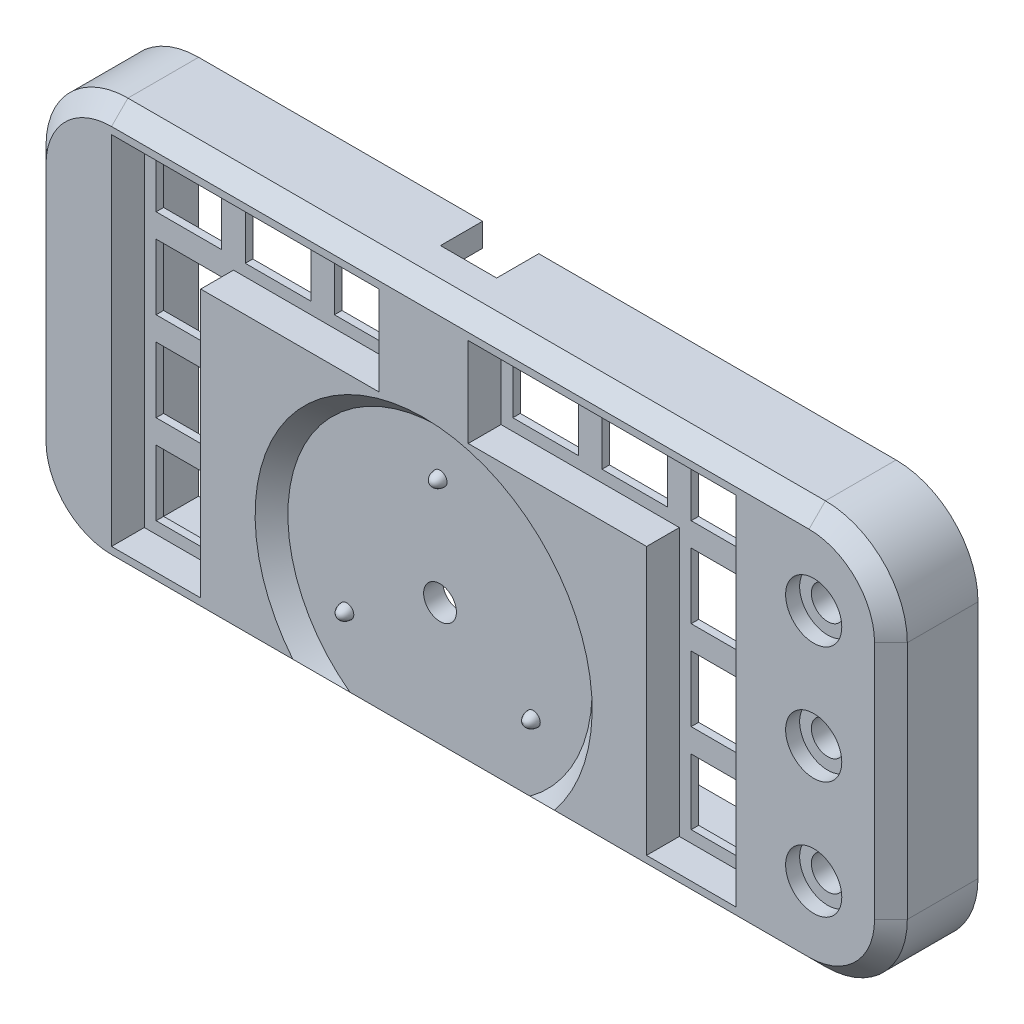
from build123d import *
from build123d.topology import SkipClean

# Parameters (mm, degrees)
CROQUIS1_W                          = 157.5
CROQUIS1_H                          = 76.2
CROQUIS1_R                          = 3.5
CROQUIS1_W_2                        = 14
CROQUIS1_H_2                        = 14
SALIENTE_EXTRUIR1_DEPTH             = 1.6
SALIENTE_EXTRUIR4_REACH             = 176.972
CROQUIS2_R                          = 3.5
SALIENTE_EXTRUIR4_DIRECTION_2_DEPTH = 3.5
SALIENTE_EXTRUIR5_START             = 3.5
CROQUIS3_R                          = 3.5
SALIENTE_EXTRUIR5_DEPTH             = 3.5
CHAFL_N1_SIZE                       = 3.5
CROQUIS4_W                          = 14.5
CROQUIS4_H                          = 14.5
CORTAR_EXTRUIR1_DEPTH               = 1
SALIENTE_EXTRUIR6_DEPTH             = 10
CROQUIS7_R                          = 4
SALIENTE_EXTRUIR7_DEPTH             = 10
CROQUIS8_R                          = 2
CORTAR_EXTRUIR2_DEPTH               = 5
CROQUIS9_W                          = 20
CROQUIS9_H                          = 32
SALIENTE_EXTRUIR8_DEPTH             = 10
CORTAR_EXTRUIR4_DEPTH               = 32
CROQUIS14_W                         = 20
CROQUIS14_H                         = 4.25
CORTAR_EXTRUIR8_DEPTH               = 22
CORTAR_EXTRUIR5_DEPTH               = 186.607785397
MATRIZC1_COUNT                      = 3
CROQUIS17_W                         = 1.5
CROQUIS17_H                         = 2
CORTAR_EXTRUIR9_DEPTH               = 2
CROQUIS18_R                         = 6
CORTAR_EXTRUIR10_DEPTH              = 3


with BuildPart() as part:
    # Croquis1 → Saliente-Extruir1 (new body)
    with BuildSketch(Plane.XY):
        with Locations((78.75, 38.1)):
            Rectangle(CROQUIS1_W, CROQUIS1_H)
        with Locations((150, 38.1)):
            Circle(CROQUIS1_R, mode=Mode.SUBTRACT)
        with Locations((150, 63.1)):
            Circle(CROQUIS1_R, mode=Mode.SUBTRACT)
        with Locations((150, 13.1)):
            Circle(CROQUIS1_R, mode=Mode.SUBTRACT)
        with Locations((66.67, 21.2)):
            Circle(CROQUIS1_R, mode=Mode.SUBTRACT)
        with Locations((28.575, 66.675)):
            Rectangle(CROQUIS1_W_2, CROQUIS1_H_2, mode=Mode.SUBTRACT)
        with Locations((9.525, 66.675)):
            Rectangle(CROQUIS1_W_2, CROQUIS1_H_2, mode=Mode.SUBTRACT)
        with Locations((47.625, 66.675)):
            Rectangle(CROQUIS1_W_2, CROQUIS1_H_2, mode=Mode.SUBTRACT)
        with Locations((85.725, 66.675)):
            Rectangle(CROQUIS1_W_2, CROQUIS1_H_2, mode=Mode.SUBTRACT)
        with Locations((104.775, 66.675)):
            Rectangle(CROQUIS1_W_2, CROQUIS1_H_2, mode=Mode.SUBTRACT)
        with Locations((123.825, 66.675)):
            Rectangle(CROQUIS1_W_2, CROQUIS1_H_2, mode=Mode.SUBTRACT)
        with Locations((9.525, 47.625)):
            Rectangle(CROQUIS1_W_2, CROQUIS1_H_2, mode=Mode.SUBTRACT)
        with Locations((123.825, 47.625)):
            Rectangle(CROQUIS1_W_2, CROQUIS1_H_2, mode=Mode.SUBTRACT)
        with Locations((9.525, 28.575)):
            Rectangle(CROQUIS1_W_2, CROQUIS1_H_2, mode=Mode.SUBTRACT)
        with Locations((123.825, 28.575)):
            Rectangle(CROQUIS1_W_2, CROQUIS1_H_2, mode=Mode.SUBTRACT)
        with Locations((9.525, 9.525)):
            Rectangle(CROQUIS1_W_2, CROQUIS1_H_2, mode=Mode.SUBTRACT)
        with Locations((123.825, 9.525)):
            Rectangle(CROQUIS1_W_2, CROQUIS1_H_2, mode=Mode.SUBTRACT)
    extrude(amount=-SALIENTE_EXTRUIR1_DEPTH)

    # Saliente-Extruir4: up to this face of the body (flat: up to its plane)
    saliente_extruir4_end = Plane(part.part.faces().sort_by_distance((80.923565815, 35.80920227, -1.6))[0])
    # Croquis2 → Saliente-Extruir4 (add, up to the picked face)
    with BuildSketch(Plane.XY, mode=Mode.PRIVATE) as saliente_extruir4_sk1:
        with BuildLine():
            Line((0, -5), (66.67, -5))
            Line((66.67, -5), (149, -5))
            ThreePointArc((149, -5), (161.374368671, 0.125631329), (166.5, 12.5))
            Line((166.5, 12.5), (166.5, 63.7))
            ThreePointArc((166.5, 63.7), (161.374368671, 76.074368671), (149, 81.2))
            Line((149, 81.2), (0, 81.2))
            ThreePointArc((0, 81.2), (-12.374368671, 76.074368671), (-17.5, 63.7))
            Line((-17.5, 63.7), (-17.5, 12.5))
            ThreePointArc((-17.5, 12.5), (-12.374368671, 0.125631329), (0, -5))
        make_face()
        with Locations((150, 13.1)):
            Circle(CROQUIS2_R, mode=Mode.SUBTRACT)
        with Locations((150, 63.1)):
            Circle(CROQUIS2_R, mode=Mode.SUBTRACT)
        with Locations((150, 38.1)):
            Circle(CROQUIS2_R, mode=Mode.SUBTRACT)
        with Locations((66.67, 21.2)):
            Circle(CROQUIS2_R, mode=Mode.SUBTRACT)
        Polygon((19.05, 0), (0, 0), (0, 76.2), (57.15, 76.2), (57.15, 57.15), (19.05, 57.15), align=None, mode=Mode.SUBTRACT)
        Polygon((114.3, 0), (133.35, 0), (133.35, 76.2), (76.2, 76.2), (76.2, 57.15), (114.3, 57.15), align=None, mode=Mode.SUBTRACT)
    saliente_extruir4_tool1 = split(extrude(saliente_extruir4_sk1.sketch, amount=-SALIENTE_EXTRUIR4_REACH, mode=Mode.PRIVATE), bisect_by=saliente_extruir4_end, keep=Keep.BOTH, mode=Mode.PRIVATE)
    add(saliente_extruir4_tool1.solids().sort_by(Axis((76.814077, 34.418078, 0), (0, 0, -1)))[0])

    # Croquis2 → Saliente-Extruir4 direction 2 (add)
    with BuildSketch(Plane.XY):
        with BuildLine():
            Line((0, -5), (66.67, -5))
            Line((66.67, -5), (149, -5))
            ThreePointArc((149, -5), (161.374368671, 0.125631329), (166.5, 12.5))
            Line((166.5, 12.5), (166.5, 63.7))
            ThreePointArc((166.5, 63.7), (161.374368671, 76.074368671), (149, 81.2))
            Line((149, 81.2), (0, 81.2))
            ThreePointArc((0, 81.2), (-12.374368671, 76.074368671), (-17.5, 63.7))
            Line((-17.5, 63.7), (-17.5, 12.5))
            ThreePointArc((-17.5, 12.5), (-12.374368671, 0.125631329), (0, -5))
        make_face()
        with Locations((150, 13.1)):
            Circle(CROQUIS2_R, mode=Mode.SUBTRACT)
        with Locations((150, 63.1)):
            Circle(CROQUIS2_R, mode=Mode.SUBTRACT)
        with Locations((150, 38.1)):
            Circle(CROQUIS2_R, mode=Mode.SUBTRACT)
        with Locations((66.67, 21.2)):
            Circle(CROQUIS2_R, mode=Mode.SUBTRACT)
        Polygon((19.05, 0), (0, 0), (0, 76.2), (57.15, 76.2), (57.15, 57.15), (19.05, 57.15), align=None, mode=Mode.SUBTRACT)
        Polygon((114.3, 0), (133.35, 0), (133.35, 76.2), (76.2, 76.2), (76.2, 57.15), (114.3, 57.15), align=None, mode=Mode.SUBTRACT)
    extrude(amount=SALIENTE_EXTRUIR4_DIRECTION_2_DEPTH)

    # Croquis3 → Saliente-Extruir5 (add)
    with BuildSketch(Plane.XY.offset(3.5).offset(SALIENTE_EXTRUIR5_START)):
        with BuildLine():
            Line((85.900444613, -5), (149, -5))
            ThreePointArc((149, -5), (161.374368671, 0.125631329), (166.5, 12.5))
            Line((166.5, 12.5), (166.5, 63.7))
            ThreePointArc((166.5, 63.7), (161.374368671, 76.074368671), (149, 81.2))
            Line((149, 81.2), (0, 81.2))
            ThreePointArc((0, 81.2), (-12.374368671, 76.074368671), (-17.5, 63.7))
            Line((-17.5, 63.7), (-17.5, 12.5))
            ThreePointArc((-17.5, 12.5), (-12.374368671, 0.125631329), (0, -5))
            Line((0, -5), (47.439555387, -5))
            ThreePointArc((47.439555387, -5), (66.67, 53.7), (85.900444613, -5))
        make_face()
        with Locations((150, 63.1)):
            Circle(CROQUIS3_R, mode=Mode.SUBTRACT)
        with Locations((150, 38.1)):
            Circle(CROQUIS3_R, mode=Mode.SUBTRACT)
        with Locations((150, 13.1)):
            Circle(CROQUIS3_R, mode=Mode.SUBTRACT)
        Polygon((76.2, 57.15), (114.3, 57.15), (114.3, 0), (133.35, 0), (133.35, 76.2), (76.2, 76.2), align=None, mode=Mode.SUBTRACT)
        Polygon((19.05, 0), (0, 0), (0, 76.2), (57.15, 76.2), (57.15, 57.15), (19.05, 57.15), align=None, mode=Mode.SUBTRACT)
    extrude(amount=-SALIENTE_EXTRUIR5_DEPTH)

    # Chaflán1
    chafl_n1_edges = [part.edges().sort_by_distance(p)[0] for p in [
        (117.450222306, -5, 7),
        (161.374368671, 0.125631329, 7),
        (166.5, 38.1, 7),
        (161.374368671, 76.074368671, 7),
        (74.5, 81.2, 7),
        (-12.374368671, 76.074368671, 7),
        (-17.5, 38.1, 7),
        (-12.374368671, 0.125631329, 7),
        (23.719777694, -5, 7),
        (66.67, 53.7, 7),
    ]]
    chamfer(chafl_n1_edges, length=CHAFL_N1_SIZE - 0.0001)  # a hair under: the kernel refuses the full size

    # Croquis4 → Cortar-Extruir1 (cut)
    with BuildSketch(Plane(origin=(0, 0, -1.6), x_dir=(-1, 0, 0), z_dir=(0, 0, -1))):
        with Locations((-150, 63.1)):
            Rectangle(CROQUIS4_W, CROQUIS4_H)
        with Locations((-150, 38.1)):
            Rectangle(CROQUIS4_W, CROQUIS4_H)
        with Locations((-150, 13.1)):
            Rectangle(CROQUIS4_W, CROQUIS4_H)
        with Locations((-66.67, 21.2)):
            Rectangle(CROQUIS4_W, CROQUIS4_H)
    extrude(amount=-CORTAR_EXTRUIR1_DEPTH, mode=Mode.SUBTRACT)

    # Croquis5 → Saliente-Extruir6 (add)
    with BuildSketch(Plane(origin=(0, 0, -1.6), x_dir=(-1, 0, 0), z_dir=(0, 0, -1))):
        with BuildLine():
            Line((0, 81.2), (-149, 81.2))
            ThreePointArc((-149, 81.2), (-161.374368671, 76.074368671), (-166.5, 63.7))
            Line((-166.5, 63.7), (-166.5, 12.5))
            ThreePointArc((-166.5, 12.5), (-161.374368671, 0.125631329), (-149, -5))
            Line((-149, -5), (0, -5))
            ThreePointArc((0, -5), (12.374368671, 0.125631329), (17.5, 12.5))
            Line((17.5, 12.5), (17.5, 63.7))
            ThreePointArc((17.5, 63.7), (12.374368671, 76.074368671), (0, 81.2))
        make_face()
        with BuildLine():
            Line((0, 76.2), (-149, 76.2))
            ThreePointArc((-149, 76.2), (-157.838834765, 72.538834765), (-161.5, 63.7))
            Line((-161.5, 63.7), (-161.5, 12.5))
            ThreePointArc((-161.5, 12.5), (-157.838834765, 3.661165235), (-149, 0))
            Line((-149, 0), (0, 0))
            Line((0, 0), (0, 76.2))
        make_face(mode=Mode.SUBTRACT)
    extrude(amount=SALIENTE_EXTRUIR6_DEPTH)

    # Croquis7 → Saliente-Extruir7 (add)
    with BuildSketch(Plane(origin=(0, 0, -1.6), x_dir=(-1, 0, 0), z_dir=(0, 0, -1))):
        with Locations((-161.5, 25.6)):
            Circle(CROQUIS7_R)
        with Locations((-161.5, 50.6)):
            Circle(CROQUIS7_R)
        with Locations((-50, 35)):
            Circle(CROQUIS7_R)
        with Locations((-85, 8)):
            Circle(CROQUIS7_R)
    extrude(amount=SALIENTE_EXTRUIR7_DEPTH)

    # Croquis8 → Cortar-Extruir2 (cut)
    with BuildSketch(Plane(origin=(0, 0, -11.6), x_dir=(-1, 0, 0), z_dir=(0, 0, -1))):
        with Locations((-161.5, 50.6)):
            Circle(CROQUIS8_R)
        with Locations((-161.5, 25.6)):
            Circle(CROQUIS8_R)
        with Locations((-85, 8)):
            Circle(CROQUIS8_R)
        with Locations((-50, 35)):
            Circle(CROQUIS8_R)
        with Locations((7.5, 8.1)):
            Circle(CROQUIS8_R)
        with Locations((7.5, 68.1)):
            Circle(CROQUIS8_R)
    extrude(amount=-CORTAR_EXTRUIR2_DEPTH, mode=Mode.SUBTRACT)

    # Croquis9 → Saliente-Extruir8 (add)
    with BuildSketch(Plane(origin=(0, 0, -1.6), x_dir=(-1, 0, 0), z_dir=(0, 0, -1))):
        with Locations((-66.67, 60.2)):
            Rectangle(CROQUIS9_W, CROQUIS9_H)
    extrude(amount=SALIENTE_EXTRUIR8_DEPTH)

    # Croquis10 → Cortar-Extruir4 (cut)
    with BuildSketch(Plane.XZ.offset(-44.2)):
        Polygon((75.92, -3.2), (57.42, -3.2), (57.42, -5.45), (57.67, -5.45), (58.42, -7.45), (56.67, -7.45), (56.67, -11.6), (76.67, -11.6), (76.67, -7.45), (74.92, -7.45), (75.67, -5.45), (75.92, -5.45), align=None)
    extrude(amount=-CORTAR_EXTRUIR4_DEPTH, mode=Mode.SUBTRACT)

    # Croquis14 → Cortar-Extruir8 (cut)
    with BuildSketch(Plane.XZ.offset(-44.2)):
        with Locations((66.67, -5.325)):
            Rectangle(CROQUIS14_W, CROQUIS14_H)
    extrude(amount=-CORTAR_EXTRUIR8_DEPTH, mode=Mode.SUBTRACT)

    # Croquis11 → Cortar-Extruir5 (cut, through all)
    with BuildSketch(Plane.XZ.offset(-76.2)):
        Polygon((60.67, -10.6), (60.67, -11.6), (72.67, -11.6), (72.67, -10.6), (72.67, -2.6), (60.67, -2.6), align=None)
    extrude(amount=-CORTAR_EXTRUIR5_DEPTH, mode=Mode.SUBTRACT)

    # Croquis16 → Revolución1 (revolve)
    with SkipClean():  # the faces are left unmerged after this step: merging them gives an invalid solid
        with BuildSketch(Plane.ZY.offset(-66.67)):
            with BuildLine():
                add(Edge.make_bspline(
                    [(5.5, 44.2), (5.5, 45.7), (3.5, 45.7)],
                    knots=[3.141592654, 3.141592654, 3.141592654, 4.71238898, 4.71238898, 4.71238898], degree=2, weights=[1, 0.707106781, 1]))
                Line((3.5, 45.7), (3.5, 44.2))
                Line((3.5, 44.2), (5.5, 44.2))
            make_face()
            with BuildLine():
                Line((5.5, 44.2), (3.5, 44.2))
                Line((3.5, 44.2), (3.5, 42.7))
                add(Edge.make_bspline(
                    [(3.5, 42.7), (5.5, 42.7), (5.5, 44.2)],
                    knots=[1.570796327, 1.570796327, 1.570796327, 3.141592654, 3.141592654, 3.141592654], degree=2, weights=[1, 0.707106781, 1]))
            make_face()
        revoluci_n1 = revolve(axis=Axis((66.67, 44.2, 3.5), (0, 0, 1)))
    add(part.part.scale(1), mode=Mode.REPLACE)  # the faces are merged on a copy

    # MatrizC1: Revolución1 ×3 about axis
    with SkipClean():  # the faces are left unmerged after this step: merging them gives an invalid solid
        matrizc1_axis = Axis((66.67, 21.2, -1.6), (0, 0, 1))
        for i in range(1, MATRIZC1_COUNT):
            add(revoluci_n1.rotate(matrizc1_axis, i * 360 / MATRIZC1_COUNT))
    add(part.part.scale(1), mode=Mode.REPLACE)  # the faces are merged on a copy

    # Croquis17 → Cortar-Extruir9 (cut)
    with BuildSketch(Plane(origin=(0, 0, -0.6), x_dir=(-1, 0, 0), z_dir=(0, 0, -1))):
        with Locations((-156.25, 63.1)):
            Rectangle(CROQUIS17_W, CROQUIS17_H)
        with Locations((-156.25, 38.1)):
            Rectangle(CROQUIS17_W, CROQUIS17_H)
        with Locations((-156.25, 13.1)):
            Rectangle(CROQUIS17_W, CROQUIS17_H)
        with Locations((-72.92, 21.2)):
            Rectangle(CROQUIS17_W, CROQUIS17_H)
    extrude(amount=-CORTAR_EXTRUIR9_DEPTH, mode=Mode.SUBTRACT)

    # Croquis18 → Cortar-Extruir10 (cut)
    with BuildSketch(Plane.XY.offset(7)):
        with Locations((150, 63.1)):
            Circle(CROQUIS18_R)
        with Locations((150, 38.1)):
            Circle(CROQUIS18_R)
        with Locations((150, 13.1)):
            Circle(CROQUIS18_R)
    extrude(amount=-CORTAR_EXTRUIR10_DEPTH, mode=Mode.SUBTRACT)


solid = part.part
